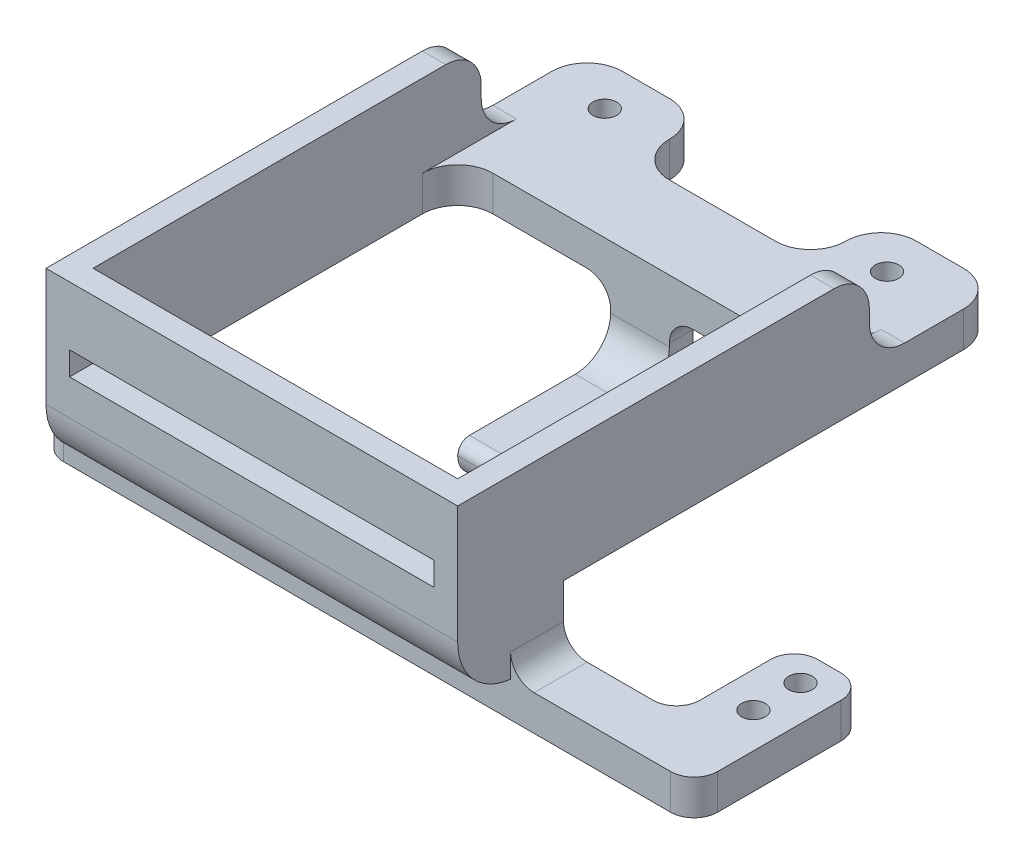
from build123d import *

# Parameters (mm, degrees)
SKETCH_1_W          = 35
SKETCH_1_H          = 35
SKETCH_1_W_2        = 31
SKETCH_1_H_2        = 31
EXTRUDE_1_DEPTH     = 10
EXTRUDE_2_DEPTH     = 5
SKETCH_3_W          = 31
SKETCH_3_H          = 7
CUT_EXTRUDE_1_DEPTH = 3
SKETCH_4_W          = 5
SKETCH_4_H          = 4.5
SKETCH_4_W_2        = 35
SKETCH_4_H_2        = 6
SKETCH_4_R          = 1
SKETCH_4_W_3        = 6
SKETCH_4_H_3        = 10
EXTRUDE_3_DEPTH     = 3
FILLET_2_R          = 2
FILLET_3_R          = 2
SKETCH_5_W          = 5
SKETCH_5_H          = 2
EXTRUDE_4_DEPTH     = 8.3
SKETCH_6_W          = 5
SKETCH_6_H          = 13
EXTRUDE_5_DEPTH     = 3
FILLET_4_R          = 2
FILLET_5_R          = 1
FILLET_6_R          = 2
SKETCH_7_W          = 31
SKETCH_7_H          = 2
CUT_EXTRUDE_2_DEPTH = 10
FILLET_7_R          = 5
SKETCH_8_W          = 35
SKETCH_8_H          = 11
SKETCH_8_R          = 1
EXTRUDE_6_DEPTH     = 3
FILLET_8_R          = 3
FILLET_9_R          = 3
SKETCH_11_W         = 15
SKETCH_11_H         = 6
CUT_EXTRUDE_4_DEPTH = 3
FILLET_START        = -1
FILLET_10_DEPTH     = 4
FILLET_10_2_DEPTH   = 3
FILLET_11_R         = 3


with BuildPart() as part:
    # 草图1 → 凸台-拉伸1 (new body)
    with BuildSketch(Plane(origin=(0, 0, 0), x_dir=(1, 0, 0), z_dir=(0, 1, 0))):
        Rectangle(SKETCH_1_W, SKETCH_1_H)
        Rectangle(SKETCH_1_W_2, SKETCH_1_H_2, mode=Mode.SUBTRACT)
    extrude(amount=EXTRUDE_1_DEPTH)

    # 草图2 → 凸台-拉伸2 (add)
    with BuildSketch(Plane.XZ):
        Polygon((15.5, 8.5), (17.5, 8.5), (17.5, 17.5), (-17.5, 17.5), (-17.5, 8.5), align=None)
    extrude(amount=EXTRUDE_2_DEPTH)

    # 草图3 → 切除-拉伸1 (cut)
    with BuildSketch(Plane(origin=(0, 0, -17.5), x_dir=(-1, 0, 0), z_dir=(0, 0, -1))):
        with Locations((0, 6.5)):
            Rectangle(SKETCH_3_W, SKETCH_3_H)
    extrude(amount=-CUT_EXTRUDE_1_DEPTH, mode=Mode.SUBTRACT)

    # 草图4 → 凸台-拉伸3 (add)
    # profile 1 of 5: a face of its own
    with BuildSketch(Plane.XZ.offset(5)):
        with Locations((-20, 10.75)):
            Rectangle(SKETCH_4_W, SKETCH_4_H)
    # profile 2 of 5: a face of its own
    with BuildSketch(Plane.XZ.offset(5)):
        with Locations((0, 10.75)):
            Rectangle(SKETCH_4_W_2, SKETCH_4_H)
    # profile 3 of 5: a face of its own
    with BuildSketch(Plane.XZ.offset(5)):
        with Locations((-20, 5.5)):
            Rectangle(SKETCH_4_W, SKETCH_4_H_2)
        with Locations(Location((-19.7, 5.46, 0), (0, 0, 270))):
            Circle(SKETCH_4_R, mode=Mode.SUBTRACT)
    # profile 4 of 5: a face of its own
    with BuildSketch(Plane.XZ.offset(5)):
        Polygon((17.5, 13), (17.5, 8.5), (27.1, 8.5), (33.1, 8.5), (33.1, 13), align=None)
    # profile 5 of 5: a face of its own
    with BuildSketch(Plane.XZ.offset(5)):
        with Locations((30.1, 3.5)):
            Rectangle(SKETCH_4_W_3, SKETCH_4_H_3)
        with Locations(Location((30.1, 0.96, 0), (0, 0, 270))):
            Circle(SKETCH_4_R, mode=Mode.SUBTRACT)
        with Locations(Location((30.1, 4.96, 0), (0, 0, 270))):
            Circle(SKETCH_4_R, mode=Mode.SUBTRACT)
    extrude(amount=EXTRUDE_3_DEPTH)

    # 圆角2
    fillet_2_edges = [part.edges().sort_by_distance(p)[0] for p in [
        (-22.5, -6.5, 13),
        (-22.5, -6.5, 2.5),
        (-17.5, -6.5, 2.5),
        (-17.5, -6.5, 8.5),
        (27.1, -6.5, 8.5),
        (27.1, -6.5, -1.5),
        (33.1, -6.5, -1.5),
        (33.1, -6.5, 13),
    ]]
    fillet(fillet_2_edges, radius=FILLET_2_R)

    # 圆角3
    fillet_3_edges = [part.edges().sort_by_distance(p)[0] for p in [
        (17.5, -5, 10.75),
        (-17.5, -5, 10.75),
    ]]
    fillet(fillet_3_edges, radius=FILLET_3_R)

    # 草图5 → 凸台-拉伸4 (add)
    with BuildSketch(Plane.XZ):
        with Locations((0, -16.5)):
            Rectangle(SKETCH_5_W, SKETCH_5_H)
    extrude(amount=EXTRUDE_4_DEPTH)

    # 草图6 → 凸台-拉伸5 (add)
    with BuildSketch(Plane.XZ.offset(8.3)):
        with Locations((0, -9)):
            Rectangle(SKETCH_6_W, SKETCH_6_H)
    extrude(amount=-EXTRUDE_5_DEPTH)

    # 圆角4
    fillet_4_edges = [part.edges().sort_by_distance(p)[0] for p in [
        (0, -8.3, -17.5),
        (0, -8.3, -2.5),
    ]]
    fillet(fillet_4_edges, radius=FILLET_4_R)

    # 圆角5
    fillet_5_edges = [part.edges().sort_by_distance(p)[0] for p in [
        (0, -5.3, -2.5),
    ]]
    fillet(fillet_5_edges, radius=FILLET_5_R - 0.0001)  # a hair under: the kernel refuses the full size

    # 圆角6
    fillet_6_edges = [part.edges().sort_by_distance(p)[0] for p in [
        (2.5, 0, -16.5),
        (-2.5, 0, -16.5),
    ]]
    fillet(fillet_6_edges, radius=FILLET_6_R)

    # 草图7 → 切除-拉伸2 (cut)
    with BuildSketch(Plane(origin=(0, 0, 15.5), x_dir=(-1, 0, 0), z_dir=(0, 0, -1))):
        with Locations((0, 4)):
            Rectangle(SKETCH_7_W, SKETCH_7_H)
    extrude(amount=-CUT_EXTRUDE_2_DEPTH, mode=Mode.SUBTRACT)

    # 圆角7
    # the kernel refuses this fillet: 5 mm, written as the material it takes off along each edge
    with BuildSketch(Plane(origin=(-15.5, 0, 8.5), x_dir=(0, -1, 0), z_dir=(1, 0, 0))) as fillet_7_piece_1:
        with BuildLine():
            CenterArc((FILLET_7_R, -FILLET_7_R), FILLET_7_R, 90, 90)
            Line((0, -FILLET_7_R), (0, 0))
            Line((0, 0), (FILLET_7_R, 0))
        make_face()
    extrude(amount=31, mode=Mode.SUBTRACT)
    with BuildSketch(Plane(origin=(29.937342964, -5, 17.5), x_dir=(0, 0, -1), z_dir=(-1, 0, 0))) as fillet_7_piece_2:
        with BuildLine():
            CenterArc((5, -4.974937186), FILLET_7_R, 95.739170477, 84.260829523)
            Line((0, -4.974937186), (0, 0))
            Line((0, 0), (4.5, 0))
        make_face()
    extrude(amount=59.874685928, mode=Mode.SUBTRACT)

    # 草图8 → 凸台-拉伸6 (add)
    with BuildSketch(Plane(origin=(0, 3, 0), x_dir=(1, 0, 0), z_dir=(0, 1, 0))):
        with Locations((0, 23)):
            Rectangle(SKETCH_8_W, SKETCH_8_H)
        with Locations(Location((11.5, 25, 0), (0, 0, 270))):
            Circle(SKETCH_8_R, mode=Mode.SUBTRACT)
        with Locations(Location((-12.5, 25, 0), (0, 0, 270))):
            Circle(SKETCH_8_R, mode=Mode.SUBTRACT)
    extrude(amount=-EXTRUDE_6_DEPTH)

    # 圆角8
    fillet_8_edges = [part.edges().sort_by_distance(p)[0] for p in [
        (16.5, 3, -17.5),
        (-16.5, 3, -17.5),
        (-17.5, 1.5, -28.5),
        (17.5, 1.5, -28.5),
        (-16.5, 10, -17.5),
        (16.5, 10, -17.5),
    ]]
    fillet(fillet_8_edges, radius=FILLET_8_R)

    # 圆角9
    fillet_9_edges = [part.edges().sort_by_distance(p)[0] for p in [
        (-15.5, 1.5, -15.5),
        (15.5, 1.5, -15.5),
    ]]
    fillet(fillet_9_edges, radius=FILLET_9_R)

    # 草图11 → 切除-拉伸4 (cut)
    with BuildSketch(Plane.XZ):
        with Locations((0, -25.5)):
            Rectangle(SKETCH_11_W, SKETCH_11_H)
    extrude(amount=-CUT_EXTRUDE_4_DEPTH, mode=Mode.SUBTRACT)

    # 圆角10: read off the stored shape, not the designer's step
    # 圆角10 outline → 圆角10 (cut)
    with BuildSketch(Plane(origin=(0, 0, 0), x_dir=(1, 0, 0), z_dir=(0, 1, 0)).offset(FILLET_START)):
        with BuildLine():
            Line((7.5, 28.5), (7.5, 25.5))
            ThreePointArc((7.5, 25.5), (8.378679656, 27.621320344), (10.5, 28.5))
            Line((10.5, 28.5), (7.5, 28.5))
        make_face()
        with BuildLine():
            ThreePointArc((-10.5, 28.5), (-8.378679656, 27.621320344), (-7.5, 25.5))
            Line((-7.5, 25.5), (-7.5, 28.5))
            Line((-7.5, 28.5), (-10.5, 28.5))
        make_face()
    extrude(amount=FILLET_10_DEPTH, mode=Mode.SUBTRACT)

    # Fillet 10 2 outline → Fillet 10 2 (add)
    with BuildSketch(Plane(origin=(0, 0, 0), x_dir=(1, 0, 0), z_dir=(0, 1, 0))):
        with BuildLine():
            Line((-7.5, 22.5), (-4.5, 22.5))
            ThreePointArc((-4.5, 22.5), (-6.621320344, 23.378679656), (-7.5, 25.5))
            Line((-7.5, 25.5), (-7.5, 22.5))
        make_face()
        with BuildLine():
            ThreePointArc((7.5, 25.5), (6.621320344, 23.378679656), (4.5, 22.5))
            Line((4.5, 22.5), (7.5, 22.5))
            Line((7.5, 22.5), (7.5, 25.5))
        make_face()
    extrude(amount=FILLET_10_2_DEPTH)

    # 圆角11
    fillet_11_edges = [part.edges().sort_by_distance(p)[0] for p in [
        (0, -5.3, -15.5),
    ]]
    fillet(fillet_11_edges, radius=FILLET_11_R)


solid = part.part
